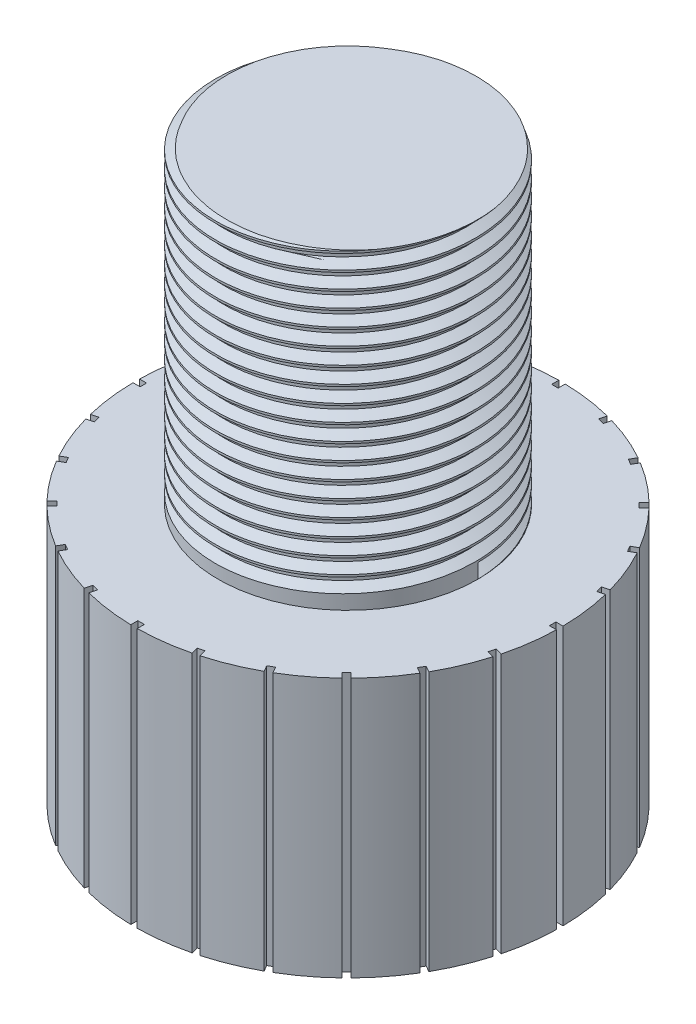
from build123d import *
from build123d.topology import SkipClean

# Parameters (mm, degrees)
SKETCH_1_R               = 4.1
EXTRUDE_1_DEPTH          = 5
SKETCH_2_R               = 2.5
EXTRUDE_2_DEPTH          = 6
THREAD_1_PITCH           = 0.3175
CUT_EXTRUDE_1_DEPTH      = 1
SKETCH_8_W               = 0.262482001
SKETCH_8_H               = 0.125261126
CUT_EXTRUDE_2_DEPTH      = 5
PATTERN_CIRCULAR_1_COUNT = 24


with BuildPart() as part:
    # 草图1 → 凸台-拉伸1 (new body)
    with BuildSketch(Plane(origin=(0, 0, 0), x_dir=(1, 0, 0), z_dir=(0, 1, 0))):
        with Locations(Location((0, 0, 0), (0, 0, 270))):
            Circle(SKETCH_1_R)
    extrude(amount=EXTRUDE_1_DEPTH)

    # Sketch 2 → 凸台-拉伸2 (add)
    with BuildSketch(Plane(origin=(0, 5, 0), x_dir=(1, 0, 0), z_dir=(0, 1, 0))):
        with Locations(Location((0, 0, 0), (0, 0, 270))):
            Circle(SKETCH_2_R)
    extrude(amount=EXTRUDE_2_DEPTH)

    # 螺纹线1: the profile of Sketch 2 2 profile screwed along a right-hand helix of 31.496063 turns, 6 arcs to a turn; built about Z, then put on its axis
    with SkipClean():  # the faces are left unmerged after this step: merging them gives an invalid solid
        thread_1_z = Axis((0, 0, 0), (0, 0, 1))
        thread_1_corners = [(2.5003, 0, -0.000173205), (2.5003, 0, 0.277985704), (2.328148085, 0, 0.17859375), (2.328148085, 0, 0.09921875)]
        with BuildLine(mode=Mode.PRIVATE) as thread_1_profile:
            Line(thread_1_corners[0], thread_1_corners[1])
            Line(thread_1_corners[1], thread_1_corners[2])
            Line(thread_1_corners[2], thread_1_corners[3])
            Line(thread_1_corners[3], thread_1_corners[0])
        thread_1_cap = Face(thread_1_profile.wire())
        thread_1_turn_angles = [0, 30, 60, 90, 120, 150, 180, 210, 240, 270, 300, 330, 360]
        thread_1_turn_weights = [1, 0.8660254037844387, 1, 0.8660254037844387, 1, 0.8660254037844387, 1, 0.8660254037844387, 1, 0.8660254037844387, 1, 0.8660254037844387, 1]
        thread_1_turn_rails = [Edge.make_bspline([Vector(p[0], p[1], 0).rotate(thread_1_z, thread_1_turn_angles[k]) / thread_1_turn_weights[k] + Vector(0, 0, p[2] + THREAD_1_PITCH * thread_1_turn_angles[k] / 360) for k in range(13)], [0, 0, 0, 1, 1, 2, 2, 3, 3, 4, 4, 5, 5, 6, 6, 6], 2, thread_1_turn_weights) for p in thread_1_corners]
        thread_1_turn_sides = [Face.make_surface_from_curves(thread_1_turn_rails[p[0]], thread_1_turn_rails[p[1]]) for p in [(0, 1), (1, 2), (2, 3), (3, 0)]]
        thread_1_last_angles = [11160, 11190, 11220, 11250, 11280, 11309.291338583, 11338.582677165]
        thread_1_last_weights = [1, 0.8660254037844387, 1, 0.8660254037844387, 1, 0.872143242535045, 1]
        thread_1_last_rails = [Edge.make_bspline([Vector(p[0], p[1], 0).rotate(thread_1_z, thread_1_last_angles[k]) / thread_1_last_weights[k] + Vector(0, 0, p[2] + THREAD_1_PITCH * thread_1_last_angles[k] / 360) for k in range(7)], [0, 0, 0, 1, 1, 2, 2, 3, 3, 3], 2, thread_1_last_weights) for p in thread_1_corners]
        thread_1_last_sides = [Face.make_surface_from_curves(thread_1_last_rails[p[0]], thread_1_last_rails[p[1]]) for p in [(0, 1), (1, 2), (2, 3), (3, 0)]]
        thread_1 = Plane(origin=(0, 5, 0), x_dir=(1, 0, 0), z_dir=(0, 1, 0)) * Solid(Shell([*[p.moved(Location((0, 0, THREAD_1_PITCH * i))) for i in range(31) for p in thread_1_turn_sides], *thread_1_last_sides, thread_1_cap, thread_1_cap.rotate(thread_1_z, 11338.582677165).moved(Location((0, 0, THREAD_1_PITCH * 11338.582677165 / 360)))]))
        add(thread_1, mode=Mode.SUBTRACT)

    # 草图7 → 切除-拉伸1 (cut)
    with SkipClean():  # the faces are left unmerged after this step: merging them gives an invalid solid
        with BuildSketch(Plane(origin=(0, 0, 0), x_dir=(-1, 0, 0), z_dir=(0, -1, 0))):
            Polygon((-2.309401077, 0), (-1.154700538, -2), (1.154700538, -2), (2.309401077, 0), (1.154700538, 2), (-1.154700538, 2), align=None)
        extrude(amount=-CUT_EXTRUDE_1_DEPTH, mode=Mode.SUBTRACT)

    # 草图8 → 切除-拉伸2 (cut)
    with SkipClean():  # the faces are left unmerged after this step: merging them gives an invalid solid
        with BuildSketch(Plane(origin=(0, 0, 0), x_dir=(-1, 0, 0), z_dir=(0, -1, 0))):
            with Locations((-4.094404246, -0.021565912)):
                Rectangle(SKETCH_8_W, SKETCH_8_H)
        cut_extrude_2 = extrude(amount=-CUT_EXTRUDE_2_DEPTH, mode=Mode.SUBTRACT)

    # 阵列(圆周)1: 切除-拉伸2 ×24 about axis
    with SkipClean():  # the faces are left unmerged after this step: merging them gives an invalid solid
        pattern_circular_1_axis = Axis((0, 0, 0), (0, 1, 0))
        for i in range(1, PATTERN_CIRCULAR_1_COUNT):
            add(cut_extrude_2.rotate(pattern_circular_1_axis, i * 360 / PATTERN_CIRCULAR_1_COUNT), mode=Mode.SUBTRACT)


solid = part.part
